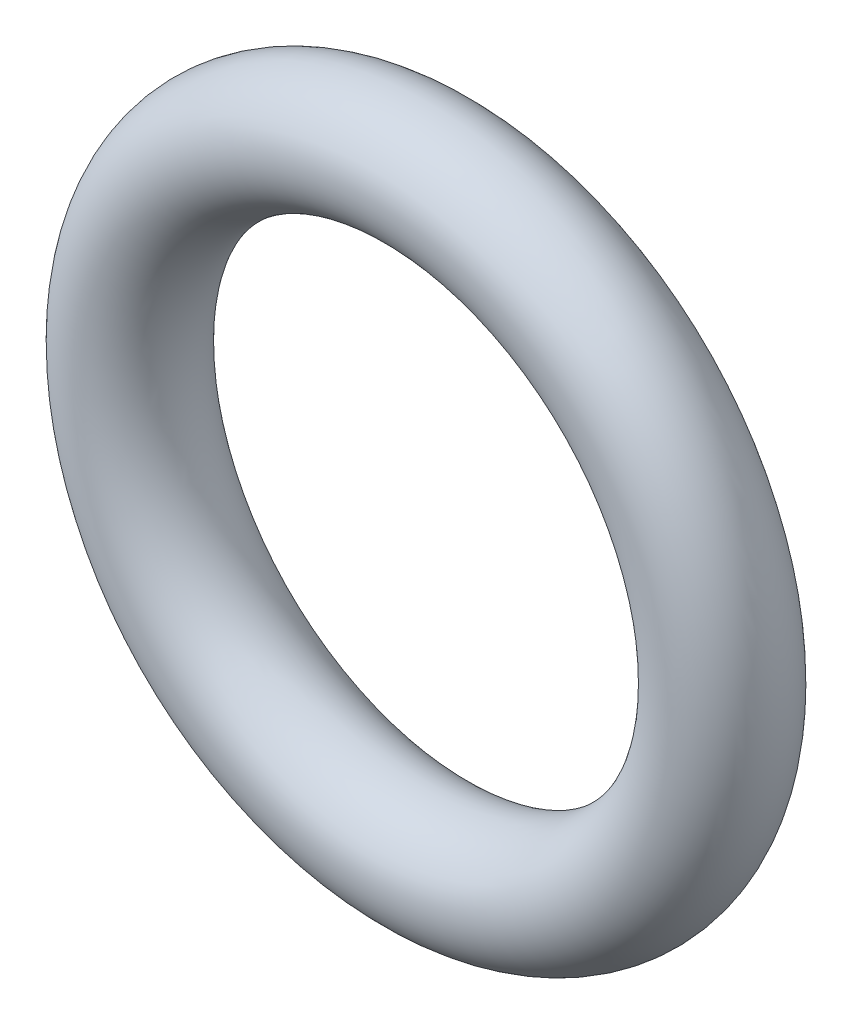
from build123d import *

# Parameters (mm, degrees)
SKETCH1_R = 0.25


with BuildPart() as part:
    # Sketch1 → Revolve1 (revolve)
    with BuildSketch(Plane(origin=(0, 0, 0), x_dir=(1, 0, 0), z_dir=(0, 1, 0))):
        with Locations((-1.25, 0)):
            Circle(SKETCH1_R)
    revolve(axis=Axis((0, 0, -88.99), (0, 0, 1)))


solid = part.part
